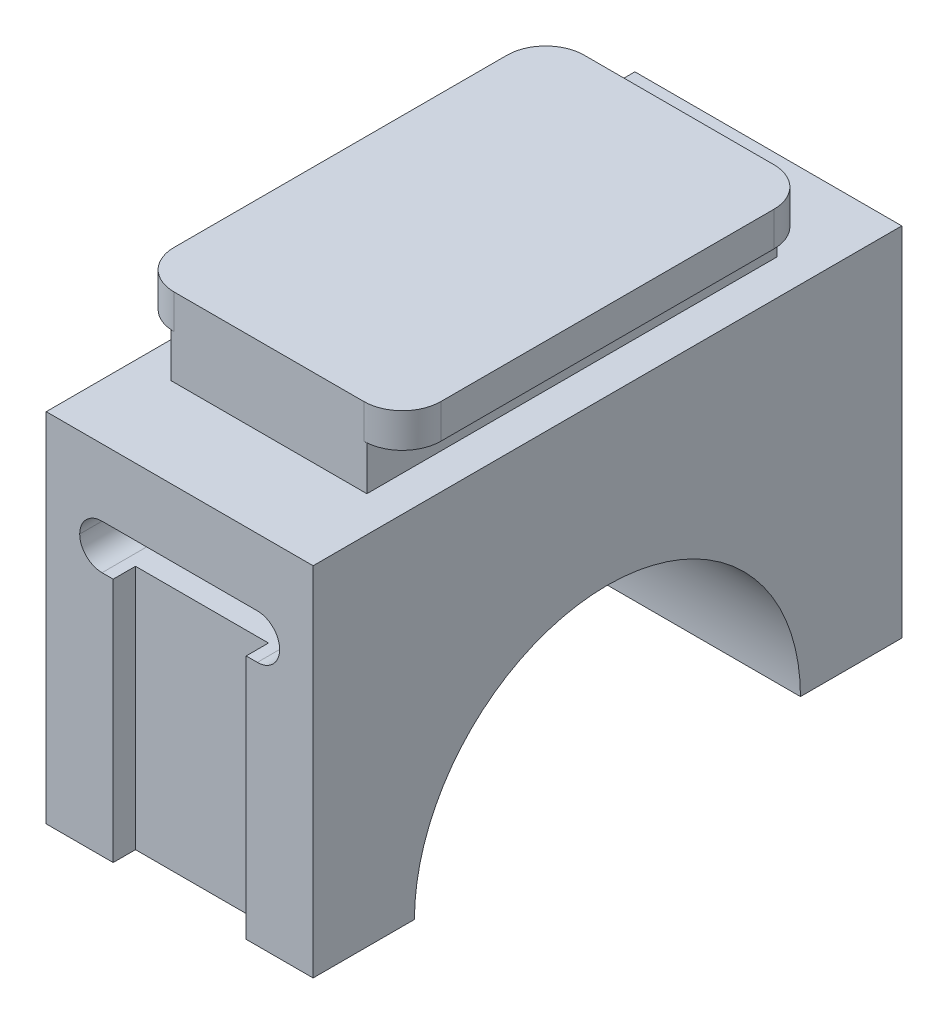
from build123d import *

# Parameters (mm, degrees)
BOSS_EXTRUDE1_DEPTH = 1.9558
SKETCH2_W           = 11.1506
SKETCH2_H           = 23.3426
BOSS_EXTRUDE2_DEPTH = 2.5019
SKETCH3_W           = 15.1892
SKETCH3_H           = 33.5026
BOSS_EXTRUDE3_DEPTH = 20.32
SKETCH4_R           = 10.9855
CUT_EXTRUDE1_DEPTH  = 40.489177087
SKETCH5_W           = 11.3792
SKETCH5_H           = 2.54
CUT_EXTRUDE2_DEPTH  = 44.289434312
FILLET1_R           = 1.27
SKETCH6_W           = 7.5692
SKETCH6_H           = 13.97
CUT_EXTRUDE3_DEPTH  = 1.27
SKETCH7_W           = 7.5692
SKETCH7_H           = 13.97
CUT_EXTRUDE4_DEPTH  = 1.27


with BuildPart() as part:
    # Sketch1 → Boss-Extrude1 (new body)
    with BuildSketch(Plane(origin=(0, 0, 0), x_dir=(1, 0, 0), z_dir=(0, 1, 0))):
        with BuildLine():
            Line((2.1971, 0), (12.9921, 0))
            ThreePointArc((12.9921, 0), (14.545684309, -0.643515691), (15.1892, -2.1971))
            Line((15.1892, -2.1971), (15.1892, -21.1455))
            ThreePointArc((15.1892, -21.1455), (14.545684309, -22.699084309), (12.9921, -23.3426))
            Line((12.9921, -23.3426), (2.1971, -23.3426))
            ThreePointArc((2.1971, -23.3426), (0.643515691, -22.699084309), (0, -21.1455))
            Line((0, -21.1455), (0, -2.1971))
            ThreePointArc((0, -2.1971), (0.643515691, -0.643515691), (2.1971, 0))
        make_face()
    extrude(amount=BOSS_EXTRUDE1_DEPTH)

    # Sketch2 → Boss-Extrude2 (add)
    with BuildSketch(Plane.XZ):
        with Locations((7.5946, 11.6713)):
            Rectangle(SKETCH2_W, SKETCH2_H)
    extrude(amount=BOSS_EXTRUDE2_DEPTH)

    # Sketch3 → Boss-Extrude3 (add)
    with BuildSketch(Plane.XZ.offset(2.5019)):
        with Locations((7.5946, 11.6713)):
            Rectangle(SKETCH3_W, SKETCH3_H)
    extrude(amount=BOSS_EXTRUDE3_DEPTH)

    # Sketch4 → Cut-Extrude1 (cut, through all)
    with BuildSketch(Plane(origin=(15.1892, 0, 0), x_dir=(0, 0, -1), z_dir=(1, 0, 0))):
        with Locations((-11.6713, -22.8219)):
            Circle(SKETCH4_R)
    extrude(amount=-CUT_EXTRUDE1_DEPTH, mode=Mode.SUBTRACT)

    # Sketch5 → Cut-Extrude2 (cut, through all)
    with BuildSketch(Plane.XY.offset(28.4226)):
        with Locations((7.5946, -7.5819)):
            Rectangle(SKETCH5_W, SKETCH5_H)
    extrude(amount=-CUT_EXTRUDE2_DEPTH, mode=Mode.SUBTRACT)

    # Fillet1
    fillet1_edges = [part.edges().sort_by_distance(p)[0] for p in [
        (13.2842, -8.8519, 11.6713),
        (13.2842, -6.3119, 11.6713),
        (1.905, -6.3119, 11.6713),
        (1.905, -8.8519, 11.6713),
    ]]
    fillet(fillet1_edges, radius=FILLET1_R - 0.0001)  # a hair under: the kernel refuses the full size

    # Sketch6 → Cut-Extrude3 (cut)
    with BuildSketch(Plane(origin=(0, 0, -5.08), x_dir=(-1, 0, 0), z_dir=(0, 0, -1))):
        with Locations((-7.5946, -15.8369)):
            Rectangle(SKETCH6_W, SKETCH6_H)
    extrude(amount=-CUT_EXTRUDE3_DEPTH, mode=Mode.SUBTRACT)

    # Sketch7 → Cut-Extrude4 (cut)
    with BuildSketch(Plane.XY.offset(28.4226)):
        with Locations((7.5946, -15.8369)):
            Rectangle(SKETCH7_W, SKETCH7_H)
    extrude(amount=-CUT_EXTRUDE4_DEPTH, mode=Mode.SUBTRACT)


solid = part.part
